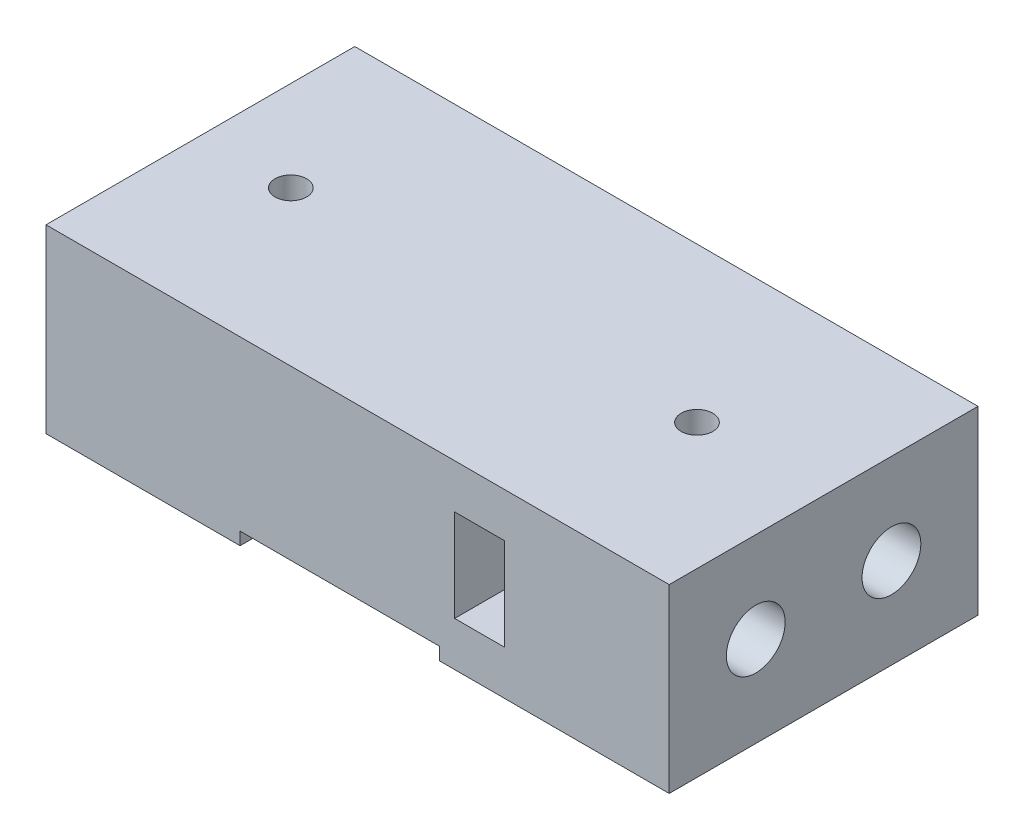
from build123d import *

# Parameters (mm, degrees)
SKETCH1_W                 = 68.896006058
SKETCH1_H                 = 34.135361424
BOSS_EXTRUDE1_DEPTH       = 20
CUT_EXTRUDE1_REACH        = 54.458
SKETCH2_W                 = 22.032289941
SKETCH2_H                 = 1.4
SKETCH7_R                 = 3.25
CUT_EXTRUDE4_DEPTH        = 30
CUT_EXTRUDE5_REACH        = 45.336
SKETCH8_R                 = 1.75
SKETCH9_W                 = 5.5
SKETCH9_H                 = 10.2
CUT_EXTRUDE6_DEPTH        = 53.458438904
SKETCH10_W                = 22.032289941
SKETCH10_H                = 2.8
CUT_EXTRUDE7_DEPTH        = 1.5
CUT_EXTRUDE7_DRAFT        = -20
LPATTERN1_COPY_1_SKETCH_W = 22.032289941
LPATTERN1_COPY_1_SKETCH_H = 2.8
LPATTERN1_COPY_1_DEPTH    = 1.5
LPATTERN1_COPY_1_DRAFT    = -20
LPATTERN1_COPY_2_SKETCH_W = 22.032289941
LPATTERN1_COPY_2_SKETCH_H = 2.8
LPATTERN1_COPY_2_DEPTH    = 1.5
LPATTERN1_COPY_2_DRAFT    = -20
LPATTERN1_COPY_3_SKETCH_W = 22.032289941
LPATTERN1_COPY_3_SKETCH_H = 2.8
LPATTERN1_COPY_3_DEPTH    = 1.5
LPATTERN1_COPY_3_DRAFT    = -20
LPATTERN1_COPY_4_SKETCH_W = 22.032289941
LPATTERN1_COPY_4_SKETCH_H = 2.8
LPATTERN1_COPY_4_DEPTH    = 1.5
LPATTERN1_COPY_4_DRAFT    = -20
LPATTERN1_COPY_5_SKETCH_W = 22.032289941
LPATTERN1_COPY_5_SKETCH_H = 2.8
LPATTERN1_COPY_5_DEPTH    = 1.5
LPATTERN1_COPY_5_DRAFT    = -20
LPATTERN1_COPY_6_SKETCH_W = 22.032289941
LPATTERN1_COPY_6_SKETCH_H = 2.8
LPATTERN1_COPY_6_DEPTH    = 1.5
LPATTERN1_COPY_6_DRAFT    = -20


with BuildPart() as part:
    # Sketch1 → Boss-Extrude1 (new body)
    with BuildSketch(Plane(origin=(0, 0, 0), x_dir=(1, 0, 0), z_dir=(0, 1, 0))):
        Rectangle(SKETCH1_W, SKETCH1_H)
    extrude(amount=BOSS_EXTRUDE1_DEPTH)

    # Sketch2 → Cut-Extrude1 (cut, up to next)
    with BuildSketch(Plane(origin=(0, 0, -17.067680712), x_dir=(-1, 0, 0), z_dir=(0, 0, -1)), mode=Mode.PRIVATE) as cut_extrude1_sk1:
        with Locations((1.973306179, 0.7)):
            Rectangle(SKETCH2_W, SKETCH2_H)
    cut_extrude1_tool1 = extrude(cut_extrude1_sk1.sketch, amount=-CUT_EXTRUDE1_REACH, mode=Mode.PRIVATE) & part.part
    add(cut_extrude1_tool1.solids().sort_by_distance((-1.973306, 0.7, -17.067681))[0], mode=Mode.SUBTRACT)

    # Sketch7 → Cut-Extrude4 (cut)
    with BuildSketch(Plane(origin=(34.448003029, 0, 0), x_dir=(0, 0, -1), z_dir=(1, 0, 0))):
        with Locations((-7.5, 10)):
            Circle(SKETCH7_R)
        with Locations((7.5, 10)):
            Circle(SKETCH7_R)
    extrude(amount=-CUT_EXTRUDE4_DEPTH, mode=Mode.SUBTRACT)

    # Sketch8 → Cut-Extrude5 (cut, up to next)
    with BuildSketch(Plane.XZ, mode=Mode.PRIVATE) as cut_extrude5_sk1:
        with Locations((-24.448003029, 0)):
            Circle(SKETCH8_R)
    cut_extrude5_tool1 = extrude(cut_extrude5_sk1.sketch, amount=-CUT_EXTRUDE5_REACH, mode=Mode.PRIVATE) & part.part
    # Sketch8 → Cut-Extrude5 (cut, up to next)
    with BuildSketch(Plane.XZ, mode=Mode.PRIVATE) as cut_extrude5_sk2:
        with Locations((20.448003029, 0)):
            Circle(SKETCH8_R)
    cut_extrude5_tool2 = extrude(cut_extrude5_sk2.sketch, amount=-CUT_EXTRUDE5_REACH, mode=Mode.PRIVATE) & part.part
    add(cut_extrude5_tool1.solids().sort_by_distance((-24.448003, 0, 0))[0], mode=Mode.SUBTRACT)
    add(cut_extrude5_tool2.solids().sort_by_distance((20.448003, 0, 0))[0], mode=Mode.SUBTRACT)

    # Sketch9 → Cut-Extrude6 (cut, through all)
    with BuildSketch(Plane(origin=(0, 0, -17.067680712), x_dir=(-1, 0, 0), z_dir=(0, 0, -1))):
        with Locations((-13.475884112, 10)):
            Rectangle(SKETCH9_W, SKETCH9_H)
    extrude(amount=-CUT_EXTRUDE6_DEPTH, mode=Mode.SUBTRACT)


with BuildPart() as cut_extrude7_tool:
    # Sketch10 → Cut-Extrude7 (with draft: the straight prism first)
    with BuildSketch(Plane.XZ.offset(-1.4)):
        with Locations((-1.973306179, 13.755042689)):
            Rectangle(SKETCH10_W, SKETCH10_H)
    extrude(amount=-CUT_EXTRUDE7_DEPTH)
    # Cut-Extrude7: the draft: its side faces are tilted about the plane it starts from
    cut_extrude7_sides = [cut_extrude7_tool.faces().sort_by_distance(p)[0] for p in [
        (-1.97330618, 2.15, 15.155042689),
        (-12.98945115, 2.15, 13.755042689),
        (-1.97330618, 2.15, 12.355042689),
        (9.042838791, 2.15, 13.755042689),
    ]]
    draft(cut_extrude7_sides, Plane.XZ.offset(-1.4), CUT_EXTRUDE7_DRAFT)


with BuildPart() as part_1:
    add(part.part)

    # Cut-Extrude7: cut by cut_extrude7_tool
    add(cut_extrude7_tool.part, mode=Mode.SUBTRACT)


with BuildPart() as lpattern1_copy_1_tool:
    # LPattern1 copy 1 sketch → LPattern1 copy 1 (with draft: the straight prism first)
    with BuildSketch(Plane(origin=(0, 1.4, -5), x_dir=(1, 0, 0), z_dir=(0, -1, 0))):
        with Locations((-1.973306179, 13.755042689)):
            Rectangle(LPATTERN1_COPY_1_SKETCH_W, LPATTERN1_COPY_1_SKETCH_H)
    extrude(amount=-LPATTERN1_COPY_1_DEPTH)
    # LPattern1 copy 1: the draft: its side faces are tilted about the plane it starts from
    lpattern1_copy_1_sides = [lpattern1_copy_1_tool.faces().sort_by_distance(p)[0] for p in [
        (-1.97330618, 2.15, 10.155042689),
        (-12.98945115, 2.15, 8.755042689),
        (-1.97330618, 2.15, 7.355042689),
        (9.042838791, 2.15, 8.755042689),
    ]]
    draft(lpattern1_copy_1_sides, Plane(origin=(0, 1.4, -5), x_dir=(1, 0, 0), z_dir=(0, -1, 0)), LPATTERN1_COPY_1_DRAFT)


with BuildPart() as part_2:
    add(part_1.part)

    # LPattern1 copy 1: cut by lpattern1_copy_1_tool
    add(lpattern1_copy_1_tool.part, mode=Mode.SUBTRACT)


with BuildPart() as lpattern1_copy_2_tool:
    # LPattern1 copy 2 sketch → LPattern1 copy 2 (with draft: the straight prism first)
    with BuildSketch(Plane(origin=(0, 1.4, -10), x_dir=(1, 0, 0), z_dir=(0, -1, 0))):
        with Locations((-1.973306179, 13.755042689)):
            Rectangle(LPATTERN1_COPY_2_SKETCH_W, LPATTERN1_COPY_2_SKETCH_H)
    extrude(amount=-LPATTERN1_COPY_2_DEPTH)
    # LPattern1 copy 2: the draft: its side faces are tilted about the plane it starts from
    lpattern1_copy_2_sides = [lpattern1_copy_2_tool.faces().sort_by_distance(p)[0] for p in [
        (-1.97330618, 2.15, 5.155042689),
        (-12.98945115, 2.15, 3.755042689),
        (-1.97330618, 2.15, 2.355042689),
        (9.042838791, 2.15, 3.755042689),
    ]]
    draft(lpattern1_copy_2_sides, Plane(origin=(0, 1.4, -10), x_dir=(1, 0, 0), z_dir=(0, -1, 0)), LPATTERN1_COPY_2_DRAFT)


with BuildPart() as part_3:
    add(part_2.part)

    # LPattern1 copy 2: cut by lpattern1_copy_2_tool
    add(lpattern1_copy_2_tool.part, mode=Mode.SUBTRACT)


with BuildPart() as lpattern1_copy_3_tool:
    # LPattern1 copy 3 sketch → LPattern1 copy 3 (with draft: the straight prism first)
    with BuildSketch(Plane(origin=(0, 1.4, -15), x_dir=(1, 0, 0), z_dir=(0, -1, 0))):
        with Locations((-1.973306179, 13.755042689)):
            Rectangle(LPATTERN1_COPY_3_SKETCH_W, LPATTERN1_COPY_3_SKETCH_H)
    extrude(amount=-LPATTERN1_COPY_3_DEPTH)
    # LPattern1 copy 3: the draft: its side faces are tilted about the plane it starts from
    lpattern1_copy_3_sides = [lpattern1_copy_3_tool.faces().sort_by_distance(p)[0] for p in [
        (-1.97330618, 2.15, 0.155042689),
        (-12.98945115, 2.15, -1.244957311),
        (-1.97330618, 2.15, -2.644957311),
        (9.042838791, 2.15, -1.244957311),
    ]]
    draft(lpattern1_copy_3_sides, Plane(origin=(0, 1.4, -15), x_dir=(1, 0, 0), z_dir=(0, -1, 0)), LPATTERN1_COPY_3_DRAFT)


with BuildPart() as part_4:
    add(part_3.part)

    # LPattern1 copy 3: cut by lpattern1_copy_3_tool
    add(lpattern1_copy_3_tool.part, mode=Mode.SUBTRACT)


with BuildPart() as lpattern1_copy_4_tool:
    # LPattern1 copy 4 sketch → LPattern1 copy 4 (with draft: the straight prism first)
    with BuildSketch(Plane(origin=(0, 1.4, -20), x_dir=(1, 0, 0), z_dir=(0, -1, 0))):
        with Locations((-1.973306179, 13.755042689)):
            Rectangle(LPATTERN1_COPY_4_SKETCH_W, LPATTERN1_COPY_4_SKETCH_H)
    extrude(amount=-LPATTERN1_COPY_4_DEPTH)
    # LPattern1 copy 4: the draft: its side faces are tilted about the plane it starts from
    lpattern1_copy_4_sides = [lpattern1_copy_4_tool.faces().sort_by_distance(p)[0] for p in [
        (-1.97330618, 2.15, -4.844957311),
        (-12.98945115, 2.15, -6.244957311),
        (-1.97330618, 2.15, -7.644957311),
        (9.042838791, 2.15, -6.244957311),
    ]]
    draft(lpattern1_copy_4_sides, Plane(origin=(0, 1.4, -20), x_dir=(1, 0, 0), z_dir=(0, -1, 0)), LPATTERN1_COPY_4_DRAFT)


with BuildPart() as part_5:
    add(part_4.part)

    # LPattern1 copy 4: cut by lpattern1_copy_4_tool
    add(lpattern1_copy_4_tool.part, mode=Mode.SUBTRACT)


with BuildPart() as lpattern1_copy_5_tool:
    # LPattern1 copy 5 sketch → LPattern1 copy 5 (with draft: the straight prism first)
    with BuildSketch(Plane(origin=(0, 1.4, -25), x_dir=(1, 0, 0), z_dir=(0, -1, 0))):
        with Locations((-1.973306179, 13.755042689)):
            Rectangle(LPATTERN1_COPY_5_SKETCH_W, LPATTERN1_COPY_5_SKETCH_H)
    extrude(amount=-LPATTERN1_COPY_5_DEPTH)
    # LPattern1 copy 5: the draft: its side faces are tilted about the plane it starts from
    lpattern1_copy_5_sides = [lpattern1_copy_5_tool.faces().sort_by_distance(p)[0] for p in [
        (-1.97330618, 2.15, -9.844957311),
        (-12.98945115, 2.15, -11.244957311),
        (-1.97330618, 2.15, -12.644957311),
        (9.042838791, 2.15, -11.244957311),
    ]]
    draft(lpattern1_copy_5_sides, Plane(origin=(0, 1.4, -25), x_dir=(1, 0, 0), z_dir=(0, -1, 0)), LPATTERN1_COPY_5_DRAFT)


with BuildPart() as part_6:
    add(part_5.part)

    # LPattern1 copy 5: cut by lpattern1_copy_5_tool
    add(lpattern1_copy_5_tool.part, mode=Mode.SUBTRACT)


with BuildPart() as lpattern1_copy_6_tool:
    # LPattern1 copy 6 sketch → LPattern1 copy 6 (with draft: the straight prism first)
    with BuildSketch(Plane(origin=(0, 1.4, -30), x_dir=(1, 0, 0), z_dir=(0, -1, 0))):
        with Locations((-1.973306179, 13.755042689)):
            Rectangle(LPATTERN1_COPY_6_SKETCH_W, LPATTERN1_COPY_6_SKETCH_H)
    extrude(amount=-LPATTERN1_COPY_6_DEPTH)
    # LPattern1 copy 6: the draft: its side faces are tilted about the plane it starts from
    lpattern1_copy_6_sides = [lpattern1_copy_6_tool.faces().sort_by_distance(p)[0] for p in [
        (-1.97330618, 2.15, -14.844957311),
        (-12.98945115, 2.15, -16.244957311),
        (-1.97330618, 2.15, -17.644957311),
        (9.042838791, 2.15, -16.244957311),
    ]]
    draft(lpattern1_copy_6_sides, Plane(origin=(0, 1.4, -30), x_dir=(1, 0, 0), z_dir=(0, -1, 0)), LPATTERN1_COPY_6_DRAFT)


with BuildPart() as part_7:
    add(part_6.part)

    # LPattern1 copy 6: cut by lpattern1_copy_6_tool
    add(lpattern1_copy_6_tool.part, mode=Mode.SUBTRACT)


solid = part_7.part
